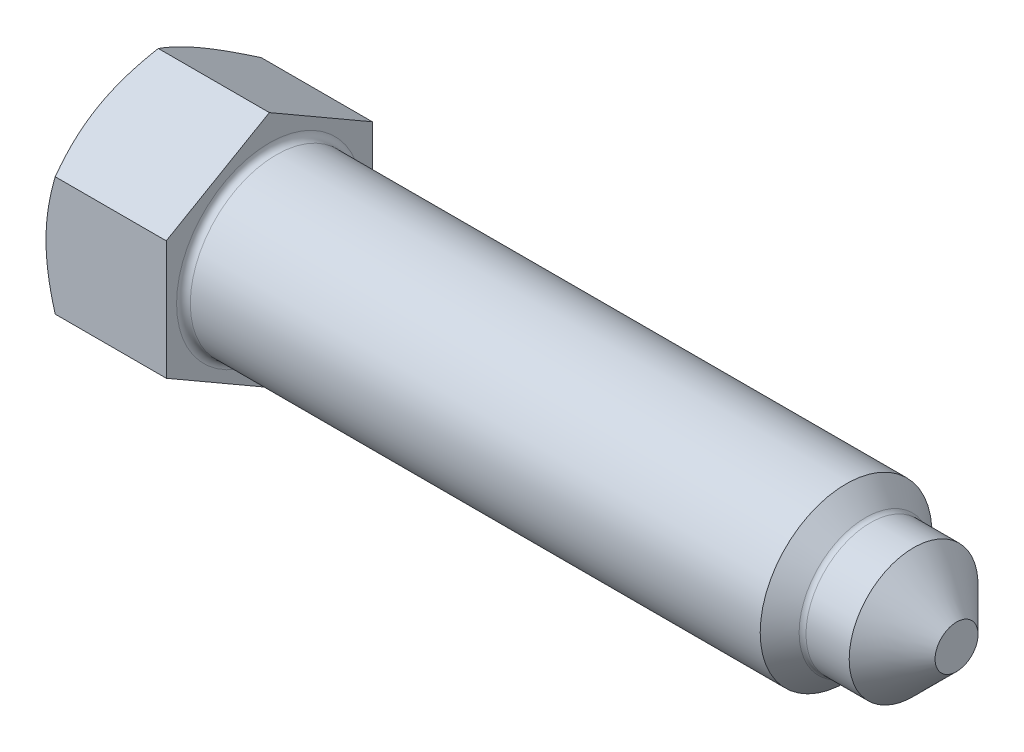
from build123d import *

# Parameters (mm, degrees)
BASEHEAD_DEPTH = 14
HEADFILLET_R   = 0.8
POINTFILLET_R  = 0.8


with BuildPart() as part:
    # HexSke → BaseHead (new body)
    with BuildSketch(Plane(origin=(0, 0, 0), x_dir=(0, 0, -1), z_dir=(1, 0, 0))):
        Polygon((12, 6.92820323), (12, -6.92820323), (0, -13.856406461), (-12, -6.92820323), (-12, 6.92820323), (0, 13.856406461), align=None)
    extrude(amount=BASEHEAD_DEPTH)

    # BodySke → BaseBody (revolve)
    with BuildSketch(Plane.XY):
        Polygon((0, 0), (94, 0), (94, 2.5), (89, 7.5), (83.64, 7.5), (81.14, 10), (0, 10), align=None)
    revolve(axis=Axis((0, 0, 0), (1, 0, 0)))

    # Sketch3 → HeadChamfer (revolve, cut)
    with BuildSketch(Plane.XY):
        Polygon((0, 12), (3.958548116, 18.856406461), (3.958548116, 23.856406461), (-10, 23.856406461), (-10, 12), align=None)
    revolve(axis=Axis((0, 0, 0), (1, 0, 0)), mode=Mode.SUBTRACT)

    # HeadFillet
    headfillet_edges = [part.edges().sort_by_distance(p)[0] for p in [
        (14, -10, 0),
    ]]
    fillet(headfillet_edges, radius=HEADFILLET_R)

    # PointFillet
    pointfillet_edges = [part.edges().sort_by_distance(p)[0] for p in [
        (83.64, -7.5, 0),
    ]]
    fillet(pointfillet_edges, radius=POINTFILLET_R)


solid = part.part
